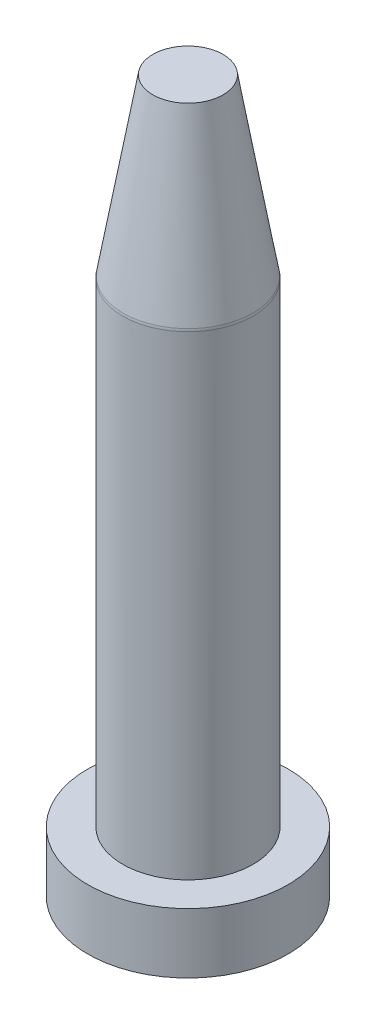
from build123d import *

# Parameters (mm, degrees)
FILLET_1_R = 3


with BuildPart() as part:
    # 草图1 → Revolve 333 (revolve)
    with BuildSketch(Plane.XY):
        Polygon((0, 0), (20, 0), (20, 12), (13, 12), (13, 107), (7, 142), (0, 142), align=None)
    revolve(axis=Axis((0, 0, 0), (0, 1, 0)))

    # 圆角1
    fillet_1_edges = [part.edges().sort_by_distance(p)[0] for p in [
        (-13, 107, 0),
    ]]
    fillet(fillet_1_edges, radius=FILLET_1_R)


solid = part.part
